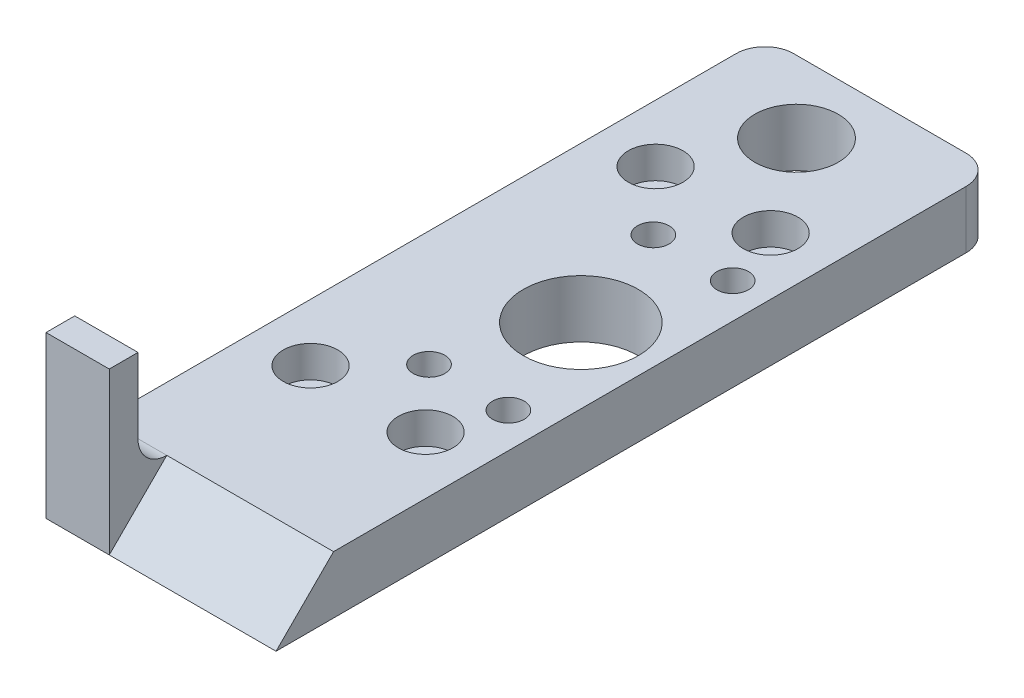
from build123d import *

# Parameters (mm, degrees)
EXTRUDE_1_DEPTH           = 20
SKETCH_2_W                = 29
SKETCH_2_H                = 5
CUT_EXTRUDE_1_DEPTH       = 18
FILLET_1_R                = 5
CHAMFER_1_SIZE            = 10
SKETCH_3_R                = 10
CUT_EXTRUDE_2_DEPTH       = 128.863208156
HOLE_WIZARD_1_D           = 5.5
HOLE_WIZARD_1_CBORE_D     = 9.5
HOLE_WIZARD_1_CBORE_DEPTH = 5.5
HOLE_WIZARD_2_D           = 5.5
HOLE_WIZARD_2_DEPTH       = 31
HOLE_WIZARD_2_CBORE_D     = 9.5
HOLE_WIZARD_2_CBORE_DEPTH = 5.5
SKETCH_9_R                = 7.25
CUT_EXTRUDE_3_DEPTH       = 128.863208156
FILLET_2_R                = 5


with BuildPart() as part:
    # 草图1 → 凸台-拉伸1 (new, symmetric)
    with BuildSketch(Plane(origin=(0, 0, 0), x_dir=(0, 0, -1), z_dir=(1, 0, 0))):
        Polygon((0, 28), (0, 0), (125, 0), (125, 10), (5, 10), (5, 28), align=None)
    extrude(amount=EXTRUDE_1_DEPTH, both=True)

    # 草图2 → 切除-拉伸1 (cut)
    with BuildSketch(Plane(origin=(0, 28, 0), x_dir=(1, 0, 0), z_dir=(0, 1, 0))):
        with Locations((5.5, 2.5)):
            Rectangle(SKETCH_2_W, SKETCH_2_H)
    extrude(amount=-CUT_EXTRUDE_1_DEPTH, mode=Mode.SUBTRACT)

    # 圆角1
    fillet_1_edges = [part.edges().sort_by_distance(p)[0] for p in [
        (-14.5, 10, -5),
    ]]
    fillet(fillet_1_edges, radius=FILLET_1_R)

    # 倒角1
    chamfer_1_edges = [part.edges().sort_by_distance(p)[0] for p in [
        (5.5, 10, 0),
    ]]
    chamfer(chamfer_1_edges, length=CHAMFER_1_SIZE - 0.0001)  # a hair under: the kernel refuses the full size

    # 草图3 → 切除-拉伸2 (cut, through all)
    with BuildSketch(Plane(origin=(0, 10, 0), x_dir=(1, 0, 0), z_dir=(0, 1, 0))):
        with Locations(Location((7, 66, 0), (0, 0, 270))):
            Circle(SKETCH_3_R)
    extrude(amount=-CUT_EXTRUDE_2_DEPTH, mode=Mode.SUBTRACT)

    # 孔1 (through all)
    with Locations(Plane.XZ):
        with Locations((13.9, -46.5), (0.1, -46.5), (0.1, -85.5), (13.9, -85.5)):
            CounterBoreHole(HOLE_WIZARD_1_D / 2, HOLE_WIZARD_1_CBORE_D / 2, HOLE_WIZARD_1_CBORE_DEPTH)

    # 孔2
    with Locations(Plane(origin=(0, 10, 0), x_dir=(-1, 0, 0), z_dir=(0, 1, 0))):
        with Locations((-10, -96), (10, -96), (10, -36), (-10, -36)):
            CounterBoreHole(HOLE_WIZARD_2_D / 2, HOLE_WIZARD_2_CBORE_D / 2, HOLE_WIZARD_2_CBORE_DEPTH, depth=HOLE_WIZARD_2_DEPTH)

    # 草图9 → 切除-拉伸3 (cut, through all)
    with BuildSketch(Plane(origin=(0, 10, 0), x_dir=(1, 0, 0), z_dir=(0, 1, 0))):
        with Locations(Location((-2, 112.5, 0), (0, 0, 270))):
            Circle(SKETCH_9_R)
    extrude(amount=-CUT_EXTRUDE_3_DEPTH, mode=Mode.SUBTRACT)

    # 圆角2
    fillet_2_edges = [part.edges().sort_by_distance(p)[0] for p in [
        (20, 5, -125),
        (-20, 5, -125),
    ]]
    fillet(fillet_2_edges, radius=FILLET_2_R)


solid = part.part
